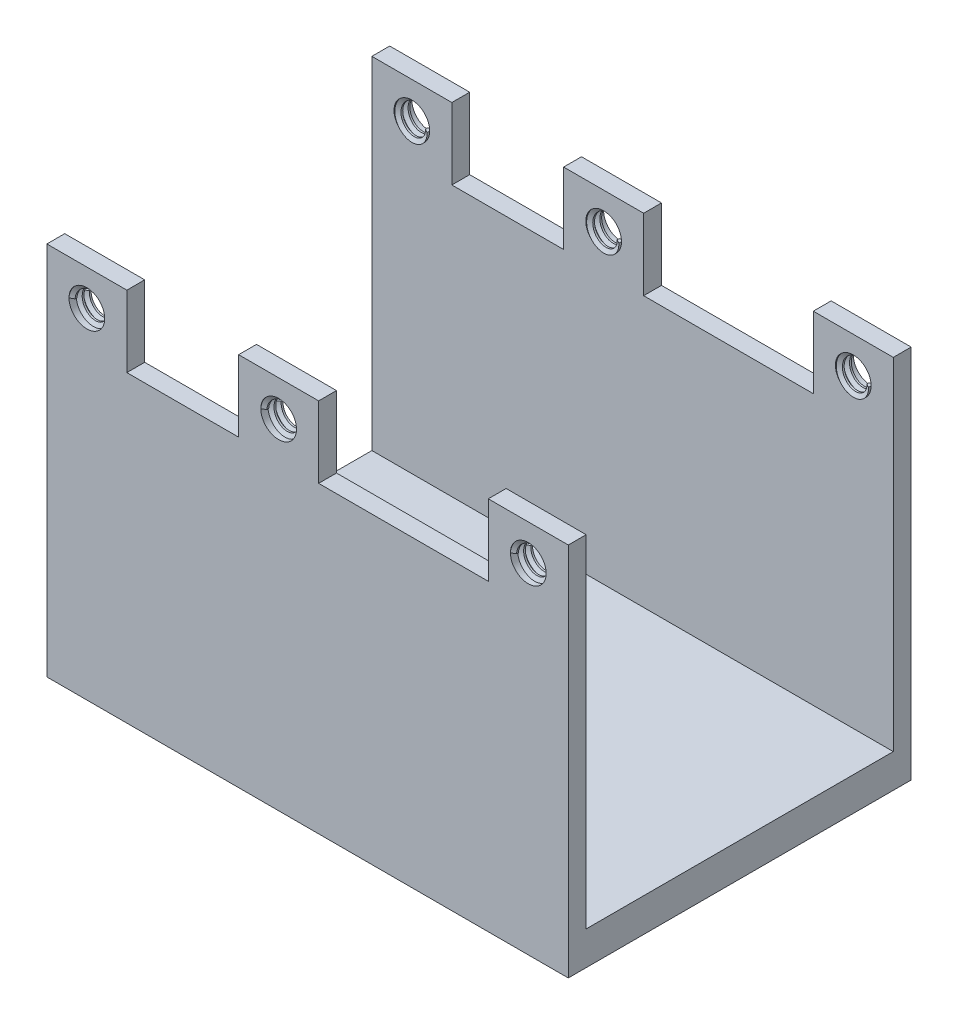
from build123d import *
from build123d.topology import SkipClean

# Parameters (mm, degrees)
BOSS_EXTRUDE1_DEPTH = 3.175
SKETCH2_W           = 92.71
SKETCH2_H           = 5.969
BOSS_EXTRUDE2_DEPTH = 54.61
SKETCH3_R           = 3.175
CUT_EXTRUDE1_DEPTH  = 105.901851592
THREAD1_PITCH       = 1.27
THREAD2_PITCH       = 1.27
THREAD3_PITCH       = 1.27
THREAD4_PITCH       = 1.27
THREAD5_PITCH       = 1.27
THREAD6_PITCH       = 1.27


with BuildPart() as part:
    # Sketch1 → Boss-Extrude1 (new body)
    with BuildSketch(Plane.XY):
        Polygon((-53.317175866, 0), (39.392824134, 0), (39.392824134, 66.675), (25.168824134, 66.675), (25.168824134, 53.975), (-4.993675866, 53.975), (-4.993675866, 66.675), (-19.217675866, 66.675), (-19.217675866, 53.975), (-39.093175866, 53.975), (-39.093175866, 66.675), (-53.317175866, 66.675), align=None)
    boss_extrude1 = extrude(amount=BOSS_EXTRUDE1_DEPTH)

    # Sketch2 → Boss-Extrude2 (add)
    with BuildSketch(Plane.XY.offset(3.175)):
        with Locations((-6.962175866, 2.9845)):
            Rectangle(SKETCH2_W, SKETCH2_H)
    extrude(amount=BOSS_EXTRUDE2_DEPTH)

    # Mirror1: Boss-Extrude1 across plane
    add(boss_extrude1.mirror(Plane.XY.offset(30.48)))

    # Sketch3 → Cut-Extrude1 (cut, through all)
    with BuildSketch(Plane.XY.offset(60.96)):
        with Locations((-46.205175866, 60.325)):
            Circle(SKETCH3_R)
        with Locations((-12.105675866, 60.325)):
            Circle(SKETCH3_R)
        with Locations((32.280824134, 60.325)):
            Circle(SKETCH3_R)
    extrude(amount=-CUT_EXTRUDE1_DEPTH, mode=Mode.SUBTRACT)

    # Thread1: the profile of Thread Profile1 profile screwed along a right-hand helix of 2 turns, 8 arcs to a turn; built about Z, then put on its axis
    with SkipClean():  # the faces are left unmerged after this step: merging them gives an invalid solid
        thread1_z = Axis((0, 0, 0), (0, 0, 1))
        thread1_corners = [(3.1753, 0, -0.000173205), (3.1753, 0, 1.111423202), (2.487592339, 0, 0.714374998), (2.487592339, 0, 0.396874998)]
        with BuildLine(mode=Mode.PRIVATE) as thread1_profile:
            Line(thread1_corners[0], thread1_corners[1])
            Line(thread1_corners[1], thread1_corners[2])
            Line(thread1_corners[2], thread1_corners[3])
            Line(thread1_corners[3], thread1_corners[0])
        thread1_cap = Face(thread1_profile.wire())
        thread1_turn_angles = [0, 22.5, 45, 67.5, 90, 112.5, 135, 157.5, 180, 202.5, 225, 247.5, 270, 292.5, 315, 337.5, 360]
        thread1_turn_weights = [1, 0.9238795325112867, 1, 0.9238795325112867, 1, 0.9238795325112867, 1, 0.9238795325112867, 1, 0.9238795325112867, 1, 0.9238795325112867, 1, 0.9238795325112867, 1, 0.9238795325112867, 1]
        thread1_turn_rails = [Edge.make_bspline([Vector(p[0], p[1], 0).rotate(thread1_z, thread1_turn_angles[k]) / thread1_turn_weights[k] + Vector(0, 0, p[2] + THREAD1_PITCH * thread1_turn_angles[k] / 360) for k in range(17)], [0, 0, 0, 1, 1, 2, 2, 3, 3, 4, 4, 5, 5, 6, 6, 7, 7, 8, 8, 8], 2, thread1_turn_weights) for p in thread1_corners]
        thread1_turn_sides = [Face.make_surface_from_curves(thread1_turn_rails[p[0]], thread1_turn_rails[p[1]]) for p in [(0, 1), (1, 2), (2, 3), (3, 0)]]
        thread1 = Plane(origin=(-46.205175866, 60.325, 60.96), x_dir=(-1, 0, 0), z_dir=(0, 0, -1)) * Solid(Shell([*[p.moved(Location((0, 0, THREAD1_PITCH * i))) for i in range(2) for p in thread1_turn_sides], thread1_cap, thread1_cap.rotate(thread1_z, 720).moved(Location((0, 0, THREAD1_PITCH * 720 / 360)))]))
        add(thread1)

    # Thread2: the profile of Thread Profile2 profile screwed along a right-hand helix of 2 turns, 8 arcs to a turn; built about Z, then put on its axis
    with SkipClean():  # the faces are left unmerged after this step: merging them gives an invalid solid
        thread2_z = Axis((0, 0, 0), (0, 0, 1))
        thread2_corners = [(3.1753, 0, -0.000173205), (3.1753, 0, 1.111423202), (2.487592339, 0, 0.714374998), (2.487592339, 0, 0.396874998)]
        with BuildLine(mode=Mode.PRIVATE) as thread2_profile:
            Line(thread2_corners[0], thread2_corners[1])
            Line(thread2_corners[1], thread2_corners[2])
            Line(thread2_corners[2], thread2_corners[3])
            Line(thread2_corners[3], thread2_corners[0])
        thread2_cap = Face(thread2_profile.wire())
        thread2_turn_angles = [0, 22.5, 45, 67.5, 90, 112.5, 135, 157.5, 180, 202.5, 225, 247.5, 270, 292.5, 315, 337.5, 360]
        thread2_turn_weights = [1, 0.9238795325112867, 1, 0.9238795325112867, 1, 0.9238795325112867, 1, 0.9238795325112867, 1, 0.9238795325112867, 1, 0.9238795325112867, 1, 0.9238795325112867, 1, 0.9238795325112867, 1]
        thread2_turn_rails = [Edge.make_bspline([Vector(p[0], p[1], 0).rotate(thread2_z, thread2_turn_angles[k]) / thread2_turn_weights[k] + Vector(0, 0, p[2] + THREAD2_PITCH * thread2_turn_angles[k] / 360) for k in range(17)], [0, 0, 0, 1, 1, 2, 2, 3, 3, 4, 4, 5, 5, 6, 6, 7, 7, 8, 8, 8], 2, thread2_turn_weights) for p in thread2_corners]
        thread2_turn_sides = [Face.make_surface_from_curves(thread2_turn_rails[p[0]], thread2_turn_rails[p[1]]) for p in [(0, 1), (1, 2), (2, 3), (3, 0)]]
        thread2 = Plane(origin=(-12.105675866, 60.325, 60.96), x_dir=(-1, 0, 0), z_dir=(0, 0, -1)) * Solid(Shell([*[p.moved(Location((0, 0, THREAD2_PITCH * i))) for i in range(2) for p in thread2_turn_sides], thread2_cap, thread2_cap.rotate(thread2_z, 720).moved(Location((0, 0, THREAD2_PITCH * 720 / 360)))]))
        add(thread2)

    # Thread3: the profile of Thread Profile3 profile screwed along a right-hand helix of 2 turns, 8 arcs to a turn; built about Z, then put on its axis
    with SkipClean():  # the faces are left unmerged after this step: merging them gives an invalid solid
        thread3_z = Axis((0, 0, 0), (0, 0, 1))
        thread3_corners = [(3.1753, 0, -0.000173205), (3.1753, 0, 1.111423202), (2.487592339, 0, 0.714374998), (2.487592339, 0, 0.396874998)]
        with BuildLine(mode=Mode.PRIVATE) as thread3_profile:
            Line(thread3_corners[0], thread3_corners[1])
            Line(thread3_corners[1], thread3_corners[2])
            Line(thread3_corners[2], thread3_corners[3])
            Line(thread3_corners[3], thread3_corners[0])
        thread3_cap = Face(thread3_profile.wire())
        thread3_turn_angles = [0, 22.5, 45, 67.5, 90, 112.5, 135, 157.5, 180, 202.5, 225, 247.5, 270, 292.5, 315, 337.5, 360]
        thread3_turn_weights = [1, 0.9238795325112867, 1, 0.9238795325112867, 1, 0.9238795325112867, 1, 0.9238795325112867, 1, 0.9238795325112867, 1, 0.9238795325112867, 1, 0.9238795325112867, 1, 0.9238795325112867, 1]
        thread3_turn_rails = [Edge.make_bspline([Vector(p[0], p[1], 0).rotate(thread3_z, thread3_turn_angles[k]) / thread3_turn_weights[k] + Vector(0, 0, p[2] + THREAD3_PITCH * thread3_turn_angles[k] / 360) for k in range(17)], [0, 0, 0, 1, 1, 2, 2, 3, 3, 4, 4, 5, 5, 6, 6, 7, 7, 8, 8, 8], 2, thread3_turn_weights) for p in thread3_corners]
        thread3_turn_sides = [Face.make_surface_from_curves(thread3_turn_rails[p[0]], thread3_turn_rails[p[1]]) for p in [(0, 1), (1, 2), (2, 3), (3, 0)]]
        thread3 = Plane(origin=(32.280824134, 60.325, 60.96), x_dir=(-1, 0, 0), z_dir=(0, 0, -1)) * Solid(Shell([*[p.moved(Location((0, 0, THREAD3_PITCH * i))) for i in range(2) for p in thread3_turn_sides], thread3_cap, thread3_cap.rotate(thread3_z, 720).moved(Location((0, 0, THREAD3_PITCH * 720 / 360)))]))
        add(thread3)

    # Thread4: the profile of Thread Profile4 profile screwed along a right-hand helix of 2 turns, 8 arcs to a turn; built about Z, then put on its axis
    with SkipClean():  # the faces are left unmerged after this step: merging them gives an invalid solid
        thread4_z = Axis((0, 0, 0), (0, 0, 1))
        thread4_corners = [(3.1753, 0, -0.000173205), (3.1753, 0, 1.111423202), (2.487592338, 0, 0.714374998), (2.487592338, 0, 0.396874998)]
        with BuildLine(mode=Mode.PRIVATE) as thread4_profile:
            Line(thread4_corners[0], thread4_corners[1])
            Line(thread4_corners[1], thread4_corners[2])
            Line(thread4_corners[2], thread4_corners[3])
            Line(thread4_corners[3], thread4_corners[0])
        thread4_cap = Face(thread4_profile.wire())
        thread4_turn_angles = [0, 22.5, 45, 67.5, 90, 112.5, 135, 157.5, 180, 202.5, 225, 247.5, 270, 292.5, 315, 337.5, 360]
        thread4_turn_weights = [1, 0.9238795325112867, 1, 0.9238795325112867, 1, 0.9238795325112867, 1, 0.9238795325112867, 1, 0.9238795325112867, 1, 0.9238795325112867, 1, 0.9238795325112867, 1, 0.9238795325112867, 1]
        thread4_turn_rails = [Edge.make_bspline([Vector(p[0], p[1], 0).rotate(thread4_z, thread4_turn_angles[k]) / thread4_turn_weights[k] + Vector(0, 0, p[2] + THREAD4_PITCH * thread4_turn_angles[k] / 360) for k in range(17)], [0, 0, 0, 1, 1, 2, 2, 3, 3, 4, 4, 5, 5, 6, 6, 7, 7, 8, 8, 8], 2, thread4_turn_weights) for p in thread4_corners]
        thread4_turn_sides = [Face.make_surface_from_curves(thread4_turn_rails[p[0]], thread4_turn_rails[p[1]]) for p in [(0, 1), (1, 2), (2, 3), (3, 0)]]
        thread4 = Plane(origin=(32.280824134, 60.325, 0), x_dir=(1, 0, 0), z_dir=(0, 0, 1)) * Solid(Shell([*[p.moved(Location((0, 0, THREAD4_PITCH * i))) for i in range(2) for p in thread4_turn_sides], thread4_cap, thread4_cap.rotate(thread4_z, 720).moved(Location((0, 0, THREAD4_PITCH * 720 / 360)))]))
        add(thread4)

    # Thread5: the profile of Thread Profile5 profile screwed along a right-hand helix of 2 turns, 8 arcs to a turn; built about Z, then put on its axis
    with SkipClean():  # the faces are left unmerged after this step: merging them gives an invalid solid
        thread5_z = Axis((0, 0, 0), (0, 0, 1))
        thread5_corners = [(3.1753, 0, -0.000173205), (3.1753, 0, 1.111423202), (2.487592338, 0, 0.714374998), (2.487592338, 0, 0.396874998)]
        with BuildLine(mode=Mode.PRIVATE) as thread5_profile:
            Line(thread5_corners[0], thread5_corners[1])
            Line(thread5_corners[1], thread5_corners[2])
            Line(thread5_corners[2], thread5_corners[3])
            Line(thread5_corners[3], thread5_corners[0])
        thread5_cap = Face(thread5_profile.wire())
        thread5_turn_angles = [0, 22.5, 45, 67.5, 90, 112.5, 135, 157.5, 180, 202.5, 225, 247.5, 270, 292.5, 315, 337.5, 360]
        thread5_turn_weights = [1, 0.9238795325112867, 1, 0.9238795325112867, 1, 0.9238795325112867, 1, 0.9238795325112867, 1, 0.9238795325112867, 1, 0.9238795325112867, 1, 0.9238795325112867, 1, 0.9238795325112867, 1]
        thread5_turn_rails = [Edge.make_bspline([Vector(p[0], p[1], 0).rotate(thread5_z, thread5_turn_angles[k]) / thread5_turn_weights[k] + Vector(0, 0, p[2] + THREAD5_PITCH * thread5_turn_angles[k] / 360) for k in range(17)], [0, 0, 0, 1, 1, 2, 2, 3, 3, 4, 4, 5, 5, 6, 6, 7, 7, 8, 8, 8], 2, thread5_turn_weights) for p in thread5_corners]
        thread5_turn_sides = [Face.make_surface_from_curves(thread5_turn_rails[p[0]], thread5_turn_rails[p[1]]) for p in [(0, 1), (1, 2), (2, 3), (3, 0)]]
        thread5 = Plane(origin=(-12.105675866, 60.325, 0), x_dir=(1, 0, 0), z_dir=(0, 0, 1)) * Solid(Shell([*[p.moved(Location((0, 0, THREAD5_PITCH * i))) for i in range(2) for p in thread5_turn_sides], thread5_cap, thread5_cap.rotate(thread5_z, 720).moved(Location((0, 0, THREAD5_PITCH * 720 / 360)))]))
        add(thread5)

    # Thread6: the profile of Thread Profile6 profile screwed along a right-hand helix of 2 turns, 8 arcs to a turn; built about Z, then put on its axis
    with SkipClean():  # the faces are left unmerged after this step: merging them gives an invalid solid
        thread6_z = Axis((0, 0, 0), (0, 0, 1))
        thread6_corners = [(3.1753, 0, -0.000173205), (3.1753, 0, 1.111423202), (2.487592338, 0, 0.714374998), (2.487592338, 0, 0.396874998)]
        with BuildLine(mode=Mode.PRIVATE) as thread6_profile:
            Line(thread6_corners[0], thread6_corners[1])
            Line(thread6_corners[1], thread6_corners[2])
            Line(thread6_corners[2], thread6_corners[3])
            Line(thread6_corners[3], thread6_corners[0])
        thread6_cap = Face(thread6_profile.wire())
        thread6_turn_angles = [0, 22.5, 45, 67.5, 90, 112.5, 135, 157.5, 180, 202.5, 225, 247.5, 270, 292.5, 315, 337.5, 360]
        thread6_turn_weights = [1, 0.9238795325112867, 1, 0.9238795325112867, 1, 0.9238795325112867, 1, 0.9238795325112867, 1, 0.9238795325112867, 1, 0.9238795325112867, 1, 0.9238795325112867, 1, 0.9238795325112867, 1]
        thread6_turn_rails = [Edge.make_bspline([Vector(p[0], p[1], 0).rotate(thread6_z, thread6_turn_angles[k]) / thread6_turn_weights[k] + Vector(0, 0, p[2] + THREAD6_PITCH * thread6_turn_angles[k] / 360) for k in range(17)], [0, 0, 0, 1, 1, 2, 2, 3, 3, 4, 4, 5, 5, 6, 6, 7, 7, 8, 8, 8], 2, thread6_turn_weights) for p in thread6_corners]
        thread6_turn_sides = [Face.make_surface_from_curves(thread6_turn_rails[p[0]], thread6_turn_rails[p[1]]) for p in [(0, 1), (1, 2), (2, 3), (3, 0)]]
        thread6 = Plane(origin=(-46.205175866, 60.325, 0), x_dir=(1, 0, 0), z_dir=(0, 0, 1)) * Solid(Shell([*[p.moved(Location((0, 0, THREAD6_PITCH * i))) for i in range(2) for p in thread6_turn_sides], thread6_cap, thread6_cap.rotate(thread6_z, 720).moved(Location((0, 0, THREAD6_PITCH * 720 / 360)))]))
        add(thread6)


solid = part.part
